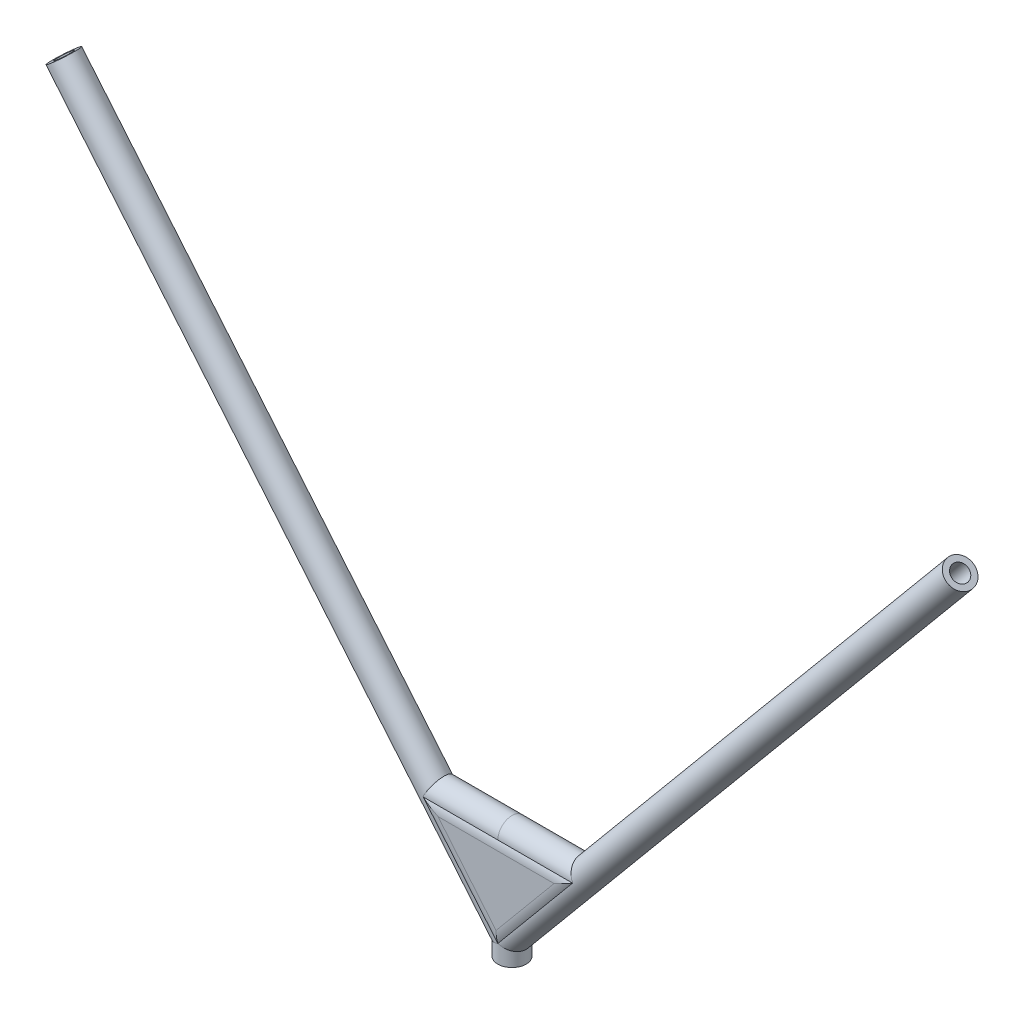
from build123d import *

# Parameters (mm, degrees)
FSAE_START                         = -390.512483795
FSAE_TUBE_15_8X3_2_4_OUTLINE_R     = 7.9
FSAE_TUBE_15_8X3_2_4_OUTLINE_R_2   = 4.7
FSAE_TUBE_15_8X3_2_4_DEPTH         = 390.512483895
FSAE_START_2                       = -6
FSAE_TUBE_15_8X3_2_4_2_DEPTH       = 29
FSAE_START_3                       = -10
FSAE_TUBE_15_8X3_2_4_3_OUTLINE_R   = 7.9
FSAE_TUBE_15_8X3_2_4_3_OUTLINE_R_2 = 4.7
FSAE_TUBE_15_8X3_2_4_3_DEPTH       = 60
SKETCH14_R                         = 7.9
SKETCH14_R_2                       = 4.7
FSAE_TUBE_15_8X3_2_5_DEPTH         = 41.666666667
MIRROR2_ANGLE                      = 180
MIRROR2_2_ANGLE                    = 180
BOSS_EXTRUDE2_DEPTH                = 1
FILLET1_R                          = 10


with BuildPart() as part:
    # Fsae tube 15.8X3.2(4): read off the stored shape, not the designer's step
    # Fsae tube 15.8X3.2(4) outline → Fsae tube 15.8X3.2(4) (new body)
    with BuildSketch(Plane(origin=(0, 0, 0), x_dir=(0.7682212795973756, 0.6401843996644802, 0), z_dir=(0.64018439966448, -0.7682212795973759, 0)).offset(FSAE_START)):
        Circle(FSAE_TUBE_15_8X3_2_4_OUTLINE_R)
        Circle(FSAE_TUBE_15_8X3_2_4_OUTLINE_R_2, mode=Mode.SUBTRACT)
    extrude(amount=FSAE_TUBE_15_8X3_2_4_DEPTH)

    # Fsae tube 15.8X3.2_4 2 outline → Fsae tube 15.8X3.2_4 2 (cut)
    with BuildSketch(Plane(origin=(0, 0, 0), x_dir=(1, 0, 0), z_dir=(0, 1, 0)).offset(FSAE_START_2)):
        with BuildLine():
            Line((8, 7.9), (0, 7.9))
            ThreePointArc((0, 7.9), (-7.9, 0), (0, -7.9))
            Line((0, -7.9), (8, -7.9))
            Line((8, -7.9), (8, 7.9))
        make_face()
    extrude(amount=FSAE_TUBE_15_8X3_2_4_2_DEPTH, mode=Mode.SUBTRACT)


with BuildPart() as body_2:
    # Fsae tube 15.8X3.2_4 3 outline → Fsae tube 15.8X3.2_4 3 (new body)
    with BuildSketch(Plane(origin=(0, 0, 0), x_dir=(1, 0, 0), z_dir=(0, 1, 0)).offset(FSAE_START_3)):
        Circle(FSAE_TUBE_15_8X3_2_4_3_OUTLINE_R)
        Circle(FSAE_TUBE_15_8X3_2_4_3_OUTLINE_R_2, mode=Mode.SUBTRACT)
    extrude(amount=FSAE_TUBE_15_8X3_2_4_3_DEPTH)


with BuildPart() as body_3:
    # Sketch14 → Fsae tube 15.8X3.2(5) (new body)
    with BuildSketch(Plane(origin=(0, 50, 0), x_dir=(0, -1, 0), z_dir=(-1, 0, 0))):
        Circle(SKETCH14_R)
        Circle(SKETCH14_R_2, mode=Mode.SUBTRACT)
    extrude(amount=FSAE_TUBE_15_8X3_2_5_DEPTH)


with BuildPart() as body_4:
    # Mirror2: read off the stored shape, not the designer's step
    # Mirror2: copy of body 3
    add(body_3.part.rotate(Axis((0, 0, 0), (0, 1, 0)), MIRROR2_ANGLE))


with BuildPart() as body_5:
    # Mirror2 2: copy of part
    add(part.part.rotate(Axis((0, 0, 0), (0, 1, 0)), MIRROR2_2_ANGLE))


with BuildPart() as body_6:
    # Sketch15 → Boss-Extrude2 (new body)
    with BuildSketch(Plane.XY.offset(-7.9)):
        Polygon((-41.666666667, 50), (0, 0), (41.666666667, 50), align=None)
    extrude(amount=-BOSS_EXTRUDE2_DEPTH)

    # Fillet1
    # the kernel refuses this fillet: 10 mm, written as the material it takes off along each edge
    with BuildSketch(Plane(origin=(52.563914026, 50, -8.9), x_dir=(0, 0, 1), z_dir=(-1, 0, 0))) as fillet1_piece_1:
        with BuildLine():
            CenterArc((10, -4.358898944), FILLET1_R, 154.158067237, 25.841932763)
            Line((0, -4.358898944), (-0.2, -4.358898944))
            Line((-0.2, -4.358898944), (-0.2, 0))
            Line((-0.2, 0), (0, 0.2))
            ThreePointArc((0, 0.2), (0.5, 0.2), (0.82, 0.087177979))
            Line((0.82, 0.087177979), (1, 0))
        make_face()
    extrude(amount=105.127828051, mode=Mode.SUBTRACT)
    with BuildSketch(Plane(origin=(-48.642914425, 58.37149731, -8.9), x_dir=(0, 0, 1), z_dir=(0.6401843996644797, -0.768221279597376, 0)), Plane(origin=(-6.976247758, -8.37149731, -8.9), x_dir=(0, 0, 1), z_dir=(0.64018439966448, 0.7682212795973759, 0))) as fillet1_piece_2:
        with BuildLine():
            CenterArc((10, -4.358898944), FILLET1_R, 154.158067237, 25.841932763)
            Line((0, -4.358898944), (-0.2, -4.358898944))
            Line((-0.2, -4.358898944), (-0.2, 0))
            Line((-0.2, 0), (0, 0.2))
            ThreePointArc((0, 0.2), (0.5, 0.2), (0.82, 0.087177979))
            Line((0.82, 0.087177979), (1, 0))
        make_face()
    extrude(amount=86.879908684, mode=Mode.SUBTRACT)


with BuildPart() as body_7:
    # Mirror3: mirrored copy
    add(body_6.part.mirror(Plane.XY))


solid = Compound([part.part, body_2.part, body_3.part, body_4.part, body_5.part, body_6.part, body_7.part])
